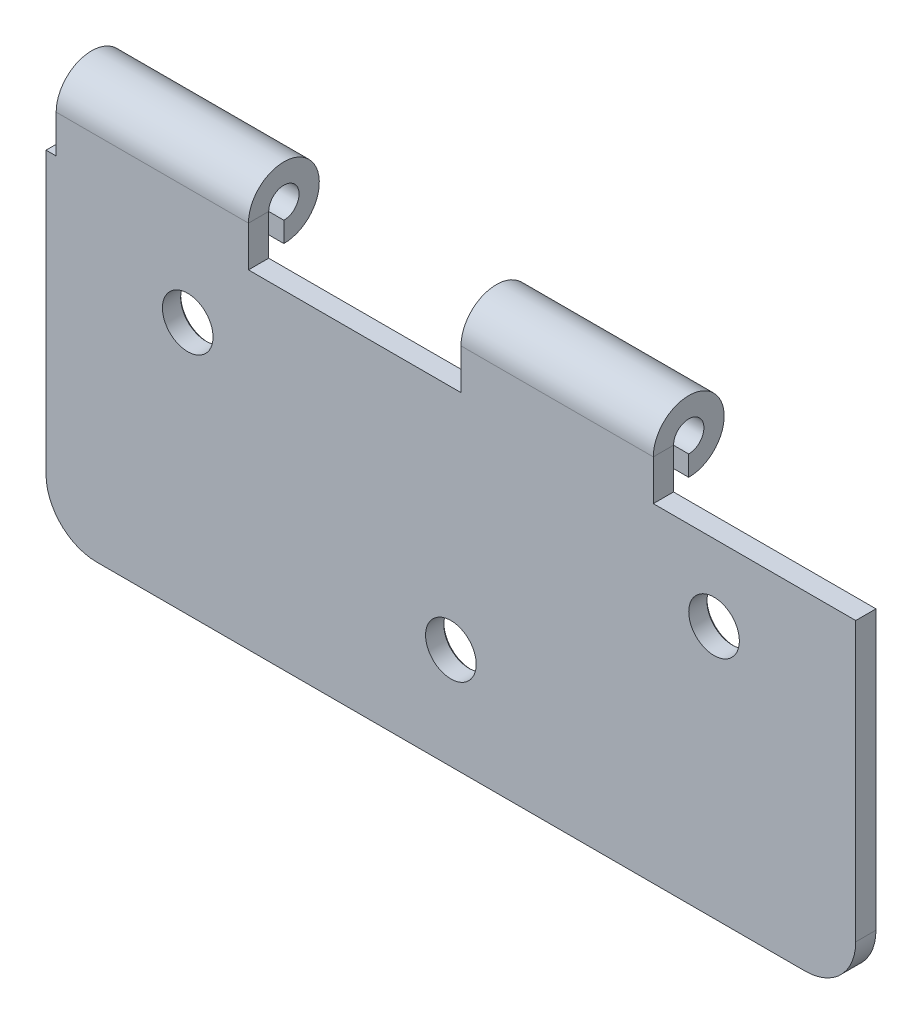
from build123d import *

# Parameters (mm, degrees)
SKETCH2_W             = 80
SKETCH2_H             = 40
BASE_FLANGE1_DEPTH    = 2
HEM1_START            = -40
HEM1_DEPTH            = 21
HEM1_2_DEPTH          = 1
HEM1_START_2          = -20
HEM1_3_DEPTH          = 1
HEM1_START_3          = -39
HEM1_4_DEPTH          = 19
HEM3_DEPTH            = 21
HEM3_2_DEPTH          = 1
HEM3_START            = 20
HEM3_3_DEPTH          = 1
HEM3_START_2          = 1
HEM3_4_DEPTH          = 19
CUT_EXTRUDE1_REACH    = 47
SKETCH13_W            = 1
SKETCH13_H            = 2.753292139
FILLET1_R             = 5
F_5_0MM_DOWEL_HOLE1_D = 5
CHAMFER1_SIZE         = 0.2


# Read off the part's stored shape, not the designer's step: Hem1, Hem3
# Sheet-metal steps are written as plain solids
with BuildPart() as part:
    # Sketch2 → Base-Flange1 (new body)
    with BuildSketch(Plane.XY):
        Rectangle(SKETCH2_W, SKETCH2_H)
    extrude(amount=-BASE_FLANGE1_DEPTH)

    # Hem1 outline → Hem1 (cut)
    with BuildSketch(Plane.YZ.offset(HEM1_START)):
        with BuildLine():
            Line((20, 0), (16.5, 0))
            ThreePointArc((16.5, 0), (18.370828693, -0.541960108), (19.66227766, -2))
            Line((19.66227766, -2), (20, -2))
            Line((20, -2), (20, 0))
        make_face()
    extrude(amount=HEM1_DEPTH, mode=Mode.SUBTRACT)

    # Hem1 2 outline → Hem1 2 (cut)
    with BuildSketch(Plane.YZ.offset(HEM1_START)):
        with BuildLine():
            Line((15.5, 0), (15.5, -2))
            Line((15.5, -2), (19.66227766, -2))
            ThreePointArc((19.66227766, -2), (18.370828693, -0.541960108), (16.5, 0))
            Line((16.5, 0), (15.5, 0))
        make_face()
    extrude(amount=HEM1_2_DEPTH, mode=Mode.SUBTRACT)

    # Hem1 3 outline → Hem1 3 (cut)
    with BuildSketch(Plane.YZ.offset(HEM1_START_2)):
        with BuildLine():
            Line((15.5, 0), (15.5, -2))
            Line((15.5, -2), (19.66227766, -2))
            ThreePointArc((19.66227766, -2), (18.370828693, -0.541960108), (16.5, 0))
            Line((16.5, 0), (15.5, 0))
        make_face()
    extrude(amount=HEM1_3_DEPTH, mode=Mode.SUBTRACT)

    # Hem1 4 outline → Hem1 4 (add)
    with BuildSketch(Plane.YZ.offset(HEM1_START_3)):
        with BuildLine():
            Line((19.66227766, -2), (16.5, -2))
            ThreePointArc((16.5, -2), (17.560660172, -4.560660172), (15, -3.5))
            Line((15, -3.5), (13, -3.5))
            ThreePointArc((13, -3.5), (17.268774411, -6.914525722), (19.66227766, -2))
        make_face()
    extrude(amount=HEM1_4_DEPTH)

    # Hem3 outline → Hem3 (cut)
    with BuildSketch(Plane.YZ):
        with BuildLine():
            Line((20, 0), (16.5, 0))
            ThreePointArc((16.5, 0), (18.370828693, -0.541960108), (19.66227766, -2))
            Line((19.66227766, -2), (20, -2))
            Line((20, -2), (20, 0))
        make_face()
    extrude(amount=HEM3_DEPTH, mode=Mode.SUBTRACT)

    # Hem3 2 outline → Hem3 2 (cut)
    with BuildSketch(Plane.YZ):
        with BuildLine():
            Line((15.5, 0), (15.5, -2))
            Line((15.5, -2), (19.66227766, -2))
            ThreePointArc((19.66227766, -2), (18.370828693, -0.541960108), (16.5, 0))
            Line((16.5, 0), (15.5, 0))
        make_face()
    extrude(amount=HEM3_2_DEPTH, mode=Mode.SUBTRACT)

    # Hem3 3 outline → Hem3 3 (cut)
    with BuildSketch(Plane.YZ.offset(HEM3_START)):
        with BuildLine():
            Line((15.5, 0), (15.5, -2))
            Line((15.5, -2), (19.66227766, -2))
            ThreePointArc((19.66227766, -2), (18.370828693, -0.541960108), (16.5, 0))
            Line((16.5, 0), (15.5, 0))
        make_face()
    extrude(amount=HEM3_3_DEPTH, mode=Mode.SUBTRACT)

    # Hem3 4 outline → Hem3 4 (add)
    with BuildSketch(Plane.YZ.offset(HEM3_START_2)):
        with BuildLine():
            Line((19.66227766, -2), (16.5, -2))
            ThreePointArc((16.5, -2), (17.560660172, -4.560660172), (15, -3.5))
            Line((15, -3.5), (13, -3.5))
            ThreePointArc((13, -3.5), (17.268774411, -6.914525722), (19.66227766, -2))
        make_face()
    extrude(amount=HEM3_4_DEPTH)

    # Sketch13 → Cut-Extrude1 (cut, up to next)
    with BuildSketch(Plane(origin=(0, 0, -2), x_dir=(-1, 0, 0), z_dir=(0, 0, -1)), mode=Mode.PRIVATE) as cut_extrude1_sk1:
        Polygon((-21, 12.5), (-40, 12.5), (-40, 20), (-21, 20), (-21, 15.5), (-20, 15.5), (-20, 12.5), align=None)
    cut_extrude1_tool1 = extrude(cut_extrude1_sk1.sketch, amount=-CUT_EXTRUDE1_REACH, mode=Mode.PRIVATE) & part.part
    # Sketch13 → Cut-Extrude1 (cut, up to next)
    with BuildSketch(Plane(origin=(0, 0, -2), x_dir=(-1, 0, 0), z_dir=(0, 0, -1)), mode=Mode.PRIVATE) as cut_extrude1_sk2:
        Polygon((19, 12.5), (0, 12.5), (-1, 12.5), (-1, 15.5), (0, 15.5), (0, 20), (19, 20), (19, 15.5), (20, 15.5), (20, 12.5), align=None)
    cut_extrude1_tool2 = extrude(cut_extrude1_sk2.sketch, amount=-CUT_EXTRUDE1_REACH, mode=Mode.PRIVATE) & part.part
    # Sketch13 → Cut-Extrude1 (cut, up to next)
    with BuildSketch(Plane(origin=(0, 0, -2), x_dir=(-1, 0, 0), z_dir=(0, 0, -1)), mode=Mode.PRIVATE) as cut_extrude1_sk3:
        with Locations((39.5, 14.123353931)):
            Rectangle(SKETCH13_W, SKETCH13_H)
    cut_extrude1_tool3 = extrude(cut_extrude1_sk3.sketch, amount=-CUT_EXTRUDE1_REACH, mode=Mode.PRIVATE) & part.part
    add(cut_extrude1_tool1.solids().sort_by_distance((30.293814, 16.203608, -2))[0], mode=Mode.SUBTRACT)
    add(cut_extrude1_tool2.solids().sort_by_distance((-9.5, 16.159091, -2))[0], mode=Mode.SUBTRACT)
    add(cut_extrude1_tool3.solids().sort_by_distance((-39.5, 14.123354, -2))[0], mode=Mode.SUBTRACT)

    # Fillet1
    fillet1_edges = [part.edges().sort_by_distance(p)[0] for p in [
        (40, -20, -1),
        (-40, -20, -1),
    ]]
    fillet(fillet1_edges, radius=FILLET1_R)

    # Ø5.0mm Dowel Hole1 (through all)
    with Locations(Plane(origin=(0, 0, -2), x_dir=(-1, 0, 0), z_dir=(0, 0, -1))):
        with Locations((-26, 5), (26, 5), (0, -10)):
            Hole(F_5_0MM_DOWEL_HOLE1_D / 2)

    # Chamfer1
    chamfer1_edges = [part.edges().sort_by_distance(p)[0] for p in [
        (-2.5, -10, -2),
        (-28.5, 5, -2),
        (23.5, 5, -2),
    ]]
    chamfer(chamfer1_edges, length=CHAMFER1_SIZE)


solid = part.part
